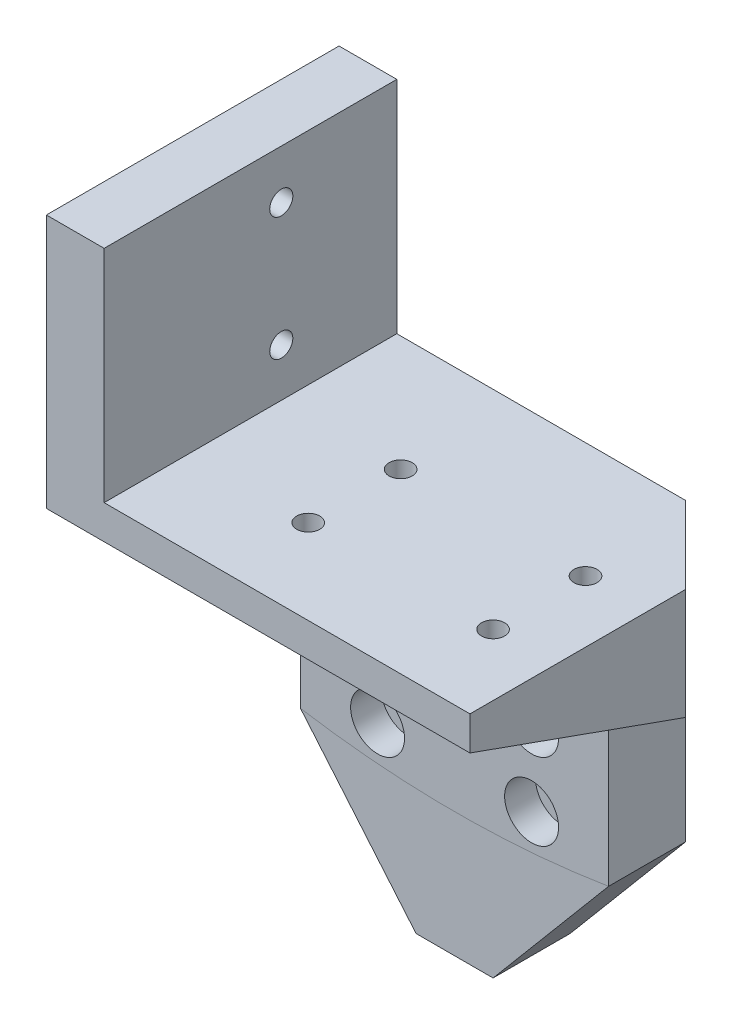
from build123d import *

# Parameters (mm, degrees)
BOSS_EXTRU_1_DEPTH      = 10
ENL_V_MAT_EXTRU_1_REACH = 128.984
ESQUISSE2_R             = 1.75
ESQUISSE4_R             = 3.5
ENL_V_MAT_EXTRU_2_DEPTH = 4
ESQUISSE5_W             = 50
ESQUISSE5_H             = 38
BOSS_EXTRU_2_DEPTH      = 14.4
ENL_V_MAT_EXTRU_3_REACH = 56.766
ESQUISSE6_R             = 1.5
ESQUISSE7_R             = 3
ENL_V_MAT_EXTRU_4_DEPTH = 9.4
CHANFREIN1_SIZE         = 10
CHANFREIN2_SIZE         = 28
CHANFREIN2_SIZE_2       = 10
BOSS_EXTRU_3_DEPTH      = 5
ESQUISSE9_W             = 38
ESQUISSE9_H             = 28.6
BOSS_EXTRU_4_DEPTH      = 2.5
CHANFREIN3_SIZE         = 5
ENL_V_MAT_EXTRU_5_REACH = 143.753
ESQUISSE10_R            = 1.5
ESQUISSE11_R            = 3
ENL_V_MAT_EXTRU_6_DEPTH = 2.5
BOSS_EXTRU_5_DEPTH      = 10
ESQUISSE14_R            = 2.75
ENL_V_MAT_EXTRU_7_DEPTH = 2


# Some blends are built 0.0001 mm under size
with BuildPart() as part:
    # Esquisse1 → Boss.-Extru.1 (new body)
    with BuildSketch(Plane.XY):
        with BuildLine():
            Line((-20, -123.389626793), (-20, -99.4))
            Line((-20, -99.4), (20, -99.4))
            Line((20, -99.4), (20, -123.389626793))
            ThreePointArc((20, -123.389626793), (0, -125), (-20, -123.389626793))
        make_face()
    extrude(amount=BOSS_EXTRU_1_DEPTH)

    # Esquisse2 → Enlèv. mat.-Extru.1 (cut, up to next)
    with BuildSketch(Plane.XY.offset(10), mode=Mode.PRIVATE) as enl_v_mat_extru_1_sk1:
        with Locations((-10, -110)):
            Circle(ESQUISSE2_R)
    enl_v_mat_extru_1_tool1 = extrude(enl_v_mat_extru_1_sk1.sketch, amount=-ENL_V_MAT_EXTRU_1_REACH, mode=Mode.PRIVATE) & part.part
    # Esquisse2 → Enlèv. mat.-Extru.1 (cut, up to next)
    with BuildSketch(Plane.XY.offset(10), mode=Mode.PRIVATE) as enl_v_mat_extru_1_sk2:
        with Locations((-10, -120)):
            Circle(ESQUISSE2_R)
    enl_v_mat_extru_1_tool2 = extrude(enl_v_mat_extru_1_sk2.sketch, amount=-ENL_V_MAT_EXTRU_1_REACH, mode=Mode.PRIVATE) & part.part
    # Esquisse2 → Enlèv. mat.-Extru.1 (cut, up to next)
    with BuildSketch(Plane.XY.offset(10), mode=Mode.PRIVATE) as enl_v_mat_extru_1_sk3:
        with Locations((10, -110)):
            Circle(ESQUISSE2_R)
    enl_v_mat_extru_1_tool3 = extrude(enl_v_mat_extru_1_sk3.sketch, amount=-ENL_V_MAT_EXTRU_1_REACH, mode=Mode.PRIVATE) & part.part
    # Esquisse2 → Enlèv. mat.-Extru.1 (cut, up to next)
    with BuildSketch(Plane.XY.offset(10), mode=Mode.PRIVATE) as enl_v_mat_extru_1_sk4:
        with Locations((10, -120)):
            Circle(ESQUISSE2_R)
    enl_v_mat_extru_1_tool4 = extrude(enl_v_mat_extru_1_sk4.sketch, amount=-ENL_V_MAT_EXTRU_1_REACH, mode=Mode.PRIVATE) & part.part
    add(enl_v_mat_extru_1_tool1.solids().sort_by_distance((-10, -110, 10))[0], mode=Mode.SUBTRACT)
    add(enl_v_mat_extru_1_tool2.solids().sort_by_distance((-10, -120, 10))[0], mode=Mode.SUBTRACT)
    add(enl_v_mat_extru_1_tool3.solids().sort_by_distance((10, -110, 10))[0], mode=Mode.SUBTRACT)
    add(enl_v_mat_extru_1_tool4.solids().sort_by_distance((10, -120, 10))[0], mode=Mode.SUBTRACT)

    # Esquisse4 → Enlèv. mat.-Extru.2 (cut)
    with BuildSketch(Plane.XY.offset(10)):
        with Locations((-10, -110)):
            Circle(ESQUISSE4_R)
        with Locations((10, -110)):
            Circle(ESQUISSE4_R)
        with Locations((10, -120)):
            Circle(ESQUISSE4_R)
        with Locations((-10, -120)):
            Circle(ESQUISSE4_R)
    extrude(amount=-ENL_V_MAT_EXTRU_2_DEPTH, mode=Mode.SUBTRACT)

    # Esquisse5 → Boss.-Extru.2 (add)
    with BuildSketch(Plane(origin=(0, -99.4, 0), x_dir=(1, 0, 0), z_dir=(0, 1, 0))):
        with Locations((5, -19)):
            Rectangle(ESQUISSE5_W, ESQUISSE5_H)
    extrude(amount=BOSS_EXTRU_2_DEPTH)

    # Esquisse6 → Enlèv. mat.-Extru.3 (cut, up to next)
    with BuildSketch(Plane.XZ.offset(99.4), mode=Mode.PRIVATE) as enl_v_mat_extru_3_sk1:
        with Locations(Location((-2, 27, 0), (0, 0, 270))):
            Circle(ESQUISSE6_R)
    enl_v_mat_extru_3_tool1 = extrude(enl_v_mat_extru_3_sk1.sketch, amount=-ENL_V_MAT_EXTRU_3_REACH, mode=Mode.PRIVATE) & part.part
    # Esquisse6 → Enlèv. mat.-Extru.3 (cut, up to next)
    with BuildSketch(Plane.XZ.offset(99.4), mode=Mode.PRIVATE) as enl_v_mat_extru_3_sk2:
        with Locations(Location((22, 27, 0), (0, 0, 270))):
            Circle(ESQUISSE6_R)
    enl_v_mat_extru_3_tool2 = extrude(enl_v_mat_extru_3_sk2.sketch, amount=-ENL_V_MAT_EXTRU_3_REACH, mode=Mode.PRIVATE) & part.part
    # Esquisse6 → Enlèv. mat.-Extru.3 (cut, up to next)
    with BuildSketch(Plane.XZ.offset(99.4), mode=Mode.PRIVATE) as enl_v_mat_extru_3_sk3:
        with Locations(Location((-2, 15, 0), (0, 0, 270))):
            Circle(ESQUISSE6_R)
    enl_v_mat_extru_3_tool3 = extrude(enl_v_mat_extru_3_sk3.sketch, amount=-ENL_V_MAT_EXTRU_3_REACH, mode=Mode.PRIVATE) & part.part
    # Esquisse6 → Enlèv. mat.-Extru.3 (cut, up to next)
    with BuildSketch(Plane.XZ.offset(99.4), mode=Mode.PRIVATE) as enl_v_mat_extru_3_sk4:
        with Locations(Location((22, 15, 0), (0, 0, 270))):
            Circle(ESQUISSE6_R)
    enl_v_mat_extru_3_tool4 = extrude(enl_v_mat_extru_3_sk4.sketch, amount=-ENL_V_MAT_EXTRU_3_REACH, mode=Mode.PRIVATE) & part.part
    add(enl_v_mat_extru_3_tool1.solids().sort_by_distance((-2, -99.4, 27))[0], mode=Mode.SUBTRACT)
    add(enl_v_mat_extru_3_tool2.solids().sort_by_distance((22, -99.4, 27))[0], mode=Mode.SUBTRACT)
    add(enl_v_mat_extru_3_tool3.solids().sort_by_distance((-2, -99.4, 15))[0], mode=Mode.SUBTRACT)
    add(enl_v_mat_extru_3_tool4.solids().sort_by_distance((22, -99.4, 15))[0], mode=Mode.SUBTRACT)

    # Esquisse7 → Enlèv. mat.-Extru.4 (cut)
    with BuildSketch(Plane.XZ.offset(99.4)):
        with Locations(Location((-2, 27, 0), (0, 0, 270))):
            Circle(ESQUISSE7_R)
        with Locations(Location((22, 27, 0), (0, 0, 270))):
            Circle(ESQUISSE7_R)
        with Locations(Location((22, 15, 0), (0, 0, 270))):
            Circle(ESQUISSE7_R)
        with Locations(Location((-2, 15, 0), (0, 0, 270))):
            Circle(ESQUISSE7_R)
    extrude(amount=-ENL_V_MAT_EXTRU_4_DEPTH, mode=Mode.SUBTRACT)

    # Chanfrein1
    chanfrein1_edges = [part.edges().sort_by_distance(p)[0] for p in [
        (30, -92.2, 0),
    ]]
    chamfer(chanfrein1_edges, length=CHANFREIN1_SIZE)

    # Chanfrein2
    # the kernel refuses this chamfer: 28, 10 mm, written as the material it takes off along each edge
    with BuildSketch(Plane(origin=(102.642981969, -99.4, 38), x_dir=(0, -0.01296397650632004, -0.9999159641255577), z_dir=(-1, 0, 0))) as chanfrein2_piece_1:
        Polygon((CHANFREIN2_SIZE * 0.999915964126, -CHANFREIN2_SIZE * 0.0129639765063), (-CHANFREIN2_SIZE_2 * 0.0129639765063, -CHANFREIN2_SIZE_2 * 0.999915964126), (0, 0), align=None)
    extrude(amount=195.285963938, mode=Mode.SUBTRACT)

    # Esquisse8 → Boss.-Extru.3 (add)
    with BuildSketch(Plane.ZY.offset(20)):
        Polygon((10, -99.4), (0, -99.4), (0, -56.4), (38, -56.4), (38, -89.4), align=None)
    extrude(amount=BOSS_EXTRU_3_DEPTH)

    # Esquisse9 → Boss.-Extru.4 (add)
    with BuildSketch(Plane(origin=(-20, 0, 0), x_dir=(0, 0, -1), z_dir=(1, 0, 0))):
        with Locations((-19, -70.7)):
            Rectangle(ESQUISSE9_W, ESQUISSE9_H)
    extrude(amount=BOSS_EXTRU_4_DEPTH)

    # Chanfrein3
    chanfrein3_edges = [part.edges().sort_by_distance(p)[0] for p in [
        (-20, -99.4, 5),
    ]]
    chamfer(chanfrein3_edges, length=CHANFREIN3_SIZE - 0.0001)  # a hair under: the kernel refuses the full size

    # Esquisse10 → Enlèv. mat.-Extru.5 (cut, up to next)
    with BuildSketch(Plane.ZY.offset(25), mode=Mode.PRIVATE) as enl_v_mat_extru_5_sk1:
        with Locations(Location((15, -62.75, 0), (0, 0, 270))):
            Circle(ESQUISSE10_R)
    enl_v_mat_extru_5_tool1 = extrude(enl_v_mat_extru_5_sk1.sketch, amount=-ENL_V_MAT_EXTRU_5_REACH, mode=Mode.PRIVATE) & part.part
    # Esquisse10 → Enlèv. mat.-Extru.5 (cut, up to next)
    with BuildSketch(Plane.ZY.offset(25), mode=Mode.PRIVATE) as enl_v_mat_extru_5_sk2:
        with Locations(Location((15, -78.75, 0), (0, 0, 270))):
            Circle(ESQUISSE10_R)
    enl_v_mat_extru_5_tool2 = extrude(enl_v_mat_extru_5_sk2.sketch, amount=-ENL_V_MAT_EXTRU_5_REACH, mode=Mode.PRIVATE) & part.part
    add(enl_v_mat_extru_5_tool1.solids().sort_by_distance((-25, -62.75, 15))[0], mode=Mode.SUBTRACT)
    add(enl_v_mat_extru_5_tool2.solids().sort_by_distance((-25, -78.75, 15))[0], mode=Mode.SUBTRACT)

    # Esquisse11 → Enlèv. mat.-Extru.6 (cut)
    with BuildSketch(Plane.ZY.offset(25)):
        with Locations(Location((15, -62.75, 0), (0, 0, 270))):
            Circle(ESQUISSE11_R)
        with Locations(Location((15, -78.75, 0), (0, 0, 270))):
            Circle(ESQUISSE11_R)
    extrude(amount=-ENL_V_MAT_EXTRU_6_DEPTH, mode=Mode.SUBTRACT)


with BuildPart() as body_2:
    # Esquisse12 → Boss.-Extru.5 (new body)
    with BuildSketch(Plane.XY.offset(10)):
        with BuildLine():
            Line((-5, -141.2), (5, -141.2))
            Line((5, -141.2), (20, -123.389626793))
            ThreePointArc((20, -123.389626793), (0, -125), (-20, -123.389626793))
            Line((-20, -123.389626793), (-5, -141.2))
        make_face()
    extrude(amount=-BOSS_EXTRU_5_DEPTH)

    # Esquisse14 → Enlèv. mat.-Extru.7 (cut)
    with BuildSketch(Plane.XZ.offset(141.2)):
        with Locations(Location((0, 5, 0), (0, 0, 270))):
            Circle(ESQUISSE14_R)
    extrude(amount=-ENL_V_MAT_EXTRU_7_DEPTH, mode=Mode.SUBTRACT)


solid = Compound([part.part, body_2.part])
